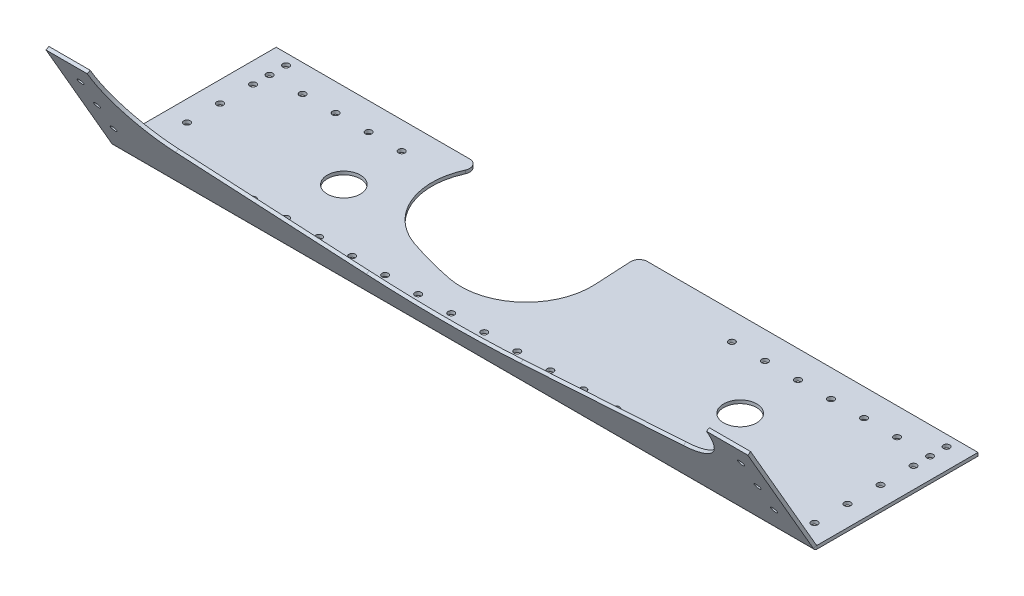
from build123d import *

# Parameters (mm, degrees)
SKETCH1_W             = 539.75
SKETCH1_H             = 127
BASE_FLANGE1_DEPTH    = 2.54
EDGE_FLANGE1_START    = -269.875
EDGE_FLANGE1_DEPTH    = 539.75
EDGE_FLANGE1_2_DEPTH  = 539.75
EDGE_FLANGE1_START_2  = -108.715226281
EDGE_FLANGE1_3_DEPTH  = 2.54
F_8_CLEARANCE_HOLE1_D = 4.9149
CUT_EXTRUDE1_DEPTH    = 335.555040238
DELETEFACE1_START     = -76.607285952
DELETEFACE1_OUTLINE_W = 2.54
DELETEFACE1_OUTLINE_H = 31
DELETEFACE1_DEPTH     = 85.478449448
FILLET1_R             = 6.35
F_8_CLEARANCE_HOLE2_D = 4.9149
SKETCH19_R            = 12.7
CUT_EXTRUDE2_DEPTH    = 335.555040319


with BuildPart() as part:
    # Base-Flange1: sheet metal written as solids
    # Sketch1 → Base-Flange1 (new body)
    with BuildSketch(Plane(origin=(0, 0, 0), x_dir=(1, 0, 0), z_dir=(0, 1, 0))):
        with Locations((0, -63.5)):
            Rectangle(SKETCH1_W, SKETCH1_H)
    extrude(amount=BASE_FLANGE1_DEPTH)

    # Edge-Flange1: read off the stored shape, not the designer's step
    # Edge-Flange1 outline → Edge-Flange1 (cut)
    with BuildSketch(Plane.YZ.offset(EDGE_FLANGE1_START)):
        with BuildLine():
            ThreePointArc((0, 123.641784424), (0.438981162, 125.280084424), (1.6383, 126.479403262))
            Line((1.6383, 126.479403262), (2.54, 127))
            Line((2.54, 127), (0, 127))
            Line((0, 127), (0, 123.641784424))
        make_face()
    extrude(amount=EDGE_FLANGE1_DEPTH, mode=Mode.SUBTRACT)

    # Edge-Flange1 2 outline → Edge-Flange1 2 (add)
    with BuildSketch(Plane.YZ.offset(EDGE_FLANGE1_START)):
        with BuildLine():
            Line((89.258181024, 177.066765158), (2.54, 127))
            Line((2.54, 127), (2.54, 123.641784424))
            ThreePointArc((2.54, 123.641784424), (2.638685688, 124.010084424), (2.9083, 124.279698737))
            Line((2.9083, 124.279698737), (90.528181024, 174.867060633))
            Line((90.528181024, 174.867060633), (89.258181024, 177.066765158))
        make_face()
    extrude(amount=EDGE_FLANGE1_2_DEPTH)

    # Edge-Flange1 3 outline → Edge-Flange1 3 (cut)
    with BuildSketch(Plane(origin=(0, 0, 0), x_dir=(1, 0, 0), z_dir=(0, 0.50000000000001, -0.8660254037844329)).offset(EDGE_FLANGE1_START_2)):
        with BuildLine():
            Line((-238.125, -165.833234842), (238.125, -165.833234842))
            ThreePointArc((238.125, -165.833234842), (225.935445104, -132.820002209), (195.216593352, -115.649943256))
            Line((195.216593352, -115.649943256), (59.186950142, -94.25854795))
            ThreePointArc((59.186950142, -94.25854795), (0, -89.633234842), (-59.186950142, -94.25854795))
            Line((-59.186950142, -94.25854795), (-195.216593352, -115.649943256))
            ThreePointArc((-195.216593352, -115.649943256), (-225.935445104, -132.820002209), (-238.125, -165.833234842))
        make_face()
    extrude(amount=EDGE_FLANGE1_3_DEPTH, mode=Mode.SUBTRACT)

    # #8 Clearance Hole1 (through all)
    with Locations(Plane(origin=(0, 0, 0), x_dir=(-1, 0, 0), z_dir=(0, -1, 0))):
        with Locations((-101.6, -20.995817153), (-127, -20.995817153), (-152.4, -20.995817153), (-177.8, -20.995817153), (-203.2, -20.995817153), (-228.6, -20.995817153), (152.4, -20.995817153), (177.8, -20.995817153), (203.2, -20.995817153), (228.6, -20.995817153), (-228.6, -109.895817153), (-203.2, -109.895817153), (-177.8, -109.895817153), (-152.4, -109.895817153), (-127, -109.895817153), (-101.6, -109.895817153), (-76.2, -109.895817153), (-50.8, -109.895817153), (-25.4, -109.895817153), (50.8, -109.895817153), (76.2, -109.895817153), (101.6, -109.895817153), (127, -109.895817153), (25.4, -109.895817153), (0, -109.895817153), (152.4, -109.895817153), (177.8, -109.895817153), (203.2, -109.895817153), (228.6, -109.895817153), (-254, -109.895817153), (-254, -59.095817153), (-254, -33.695817153), (-254, -8.295817153), (-254, -84.495817153), (254, -109.895817153), (254, -84.495817153), (254, -59.095817153), (254, -33.695817153), (254, -8.295817153), (254, -20.995817153), (-254, -20.995817153)):
            Hole(F_8_CLEARANCE_HOLE1_D / 2)

    # Sketch12 → Cut-Extrude1 (cut, through all)
    with BuildSketch(Plane(origin=(0, 2.54, 0), x_dir=(1, 0, 0), z_dir=(0, 1, 0))):
        with BuildLine():
            Line((10.750764667, -35.632627255), (10.064214119, -22.532462404))
            ThreePointArc((10.064214119, -22.532462404), (8.049198612, -18.216593523), (3.600048039, -16.515984552))
            ThreePointArc((3.600048039, -16.515984552), (-48.154577437, -10.211146763), (-96.127816756, 10.206016283))
            ThreePointArc((-96.127816756, 10.206016283), (-100.831198663, 10.957820999), (-104.734187721, 8.227676662))
            Line((-104.734187721, 8.227676662), (-111.878840363, -2.77412362))
            ThreePointArc((-111.878840363, -2.77412362), (-117.278135386, -46.313585823), (-86.367734849, -77.4485227))
            ThreePointArc((-86.367734849, -77.4485227), (-67.71223858, -83.201331827), (-48.679700327, -87.547001114))
            ThreePointArc((-48.679700327, -87.547001114), (-6.343039783, -76.038555102), (10.750764667, -35.632627255))
        make_face()
    extrude(amount=-CUT_EXTRUDE1_DEPTH, mode=Mode.SUBTRACT)

    # DeleteFace1: read off the stored shape, not the designer's step
    # DeleteFace1 outline → DeleteFace1 (cut)
    with BuildSketch(Plane(origin=(0, 0, 0), x_dir=(0, 1, 0), z_dir=(0.9986295347545738, 0, -0.052335956242945486)).offset(DELETEFACE1_START)):
        with Locations((1.27, 9.5)):
            Rectangle(DELETEFACE1_OUTLINE_W, DELETEFACE1_OUTLINE_H)
    extrude(amount=DELETEFACE1_DEPTH, mode=Mode.SUBTRACT)

    # Fillet1
    fillet1_edges = [part.edges().sort_by_distance(p)[0] for p in [
        (8.883337802, 1.27, 0),
        (-110.07730342, 1.27, 0),
    ]]
    fillet(fillet1_edges, radius=FILLET1_R)

    # #8 Clearance Hole2 (through all)
    with Locations(Plane(origin=(0, -53.08761314, 91.950443212), x_dir=(-1, 0, 0), z_dir=(0, 0.5000000000000102, -0.8660254037844328))):
        with Locations((-254, 144.334416739), (-254, 118.934416739), (-254, 93.534416739), (254, 93.534416739), (254, 118.934416739), (254, 144.334416739)):
            Hole(F_8_CLEARANCE_HOLE2_D / 2)

    # Sketch19 → Cut-Extrude2 (cut, through all)
    with BuildSketch(Plane(origin=(0, 2.54, 0), x_dir=(1, 0, 0), z_dir=(0, 1, 0))):
        with Locations(Location((152.4, -65.445817153, 0), (0, 0, 270))):
            Circle(SKETCH19_R)
        with Locations(Location((-152.4, -65.445817153, 0), (0, 0, 270))):
            Circle(SKETCH19_R)
    extrude(amount=-CUT_EXTRUDE2_DEPTH, mode=Mode.SUBTRACT)


solid = part.part
